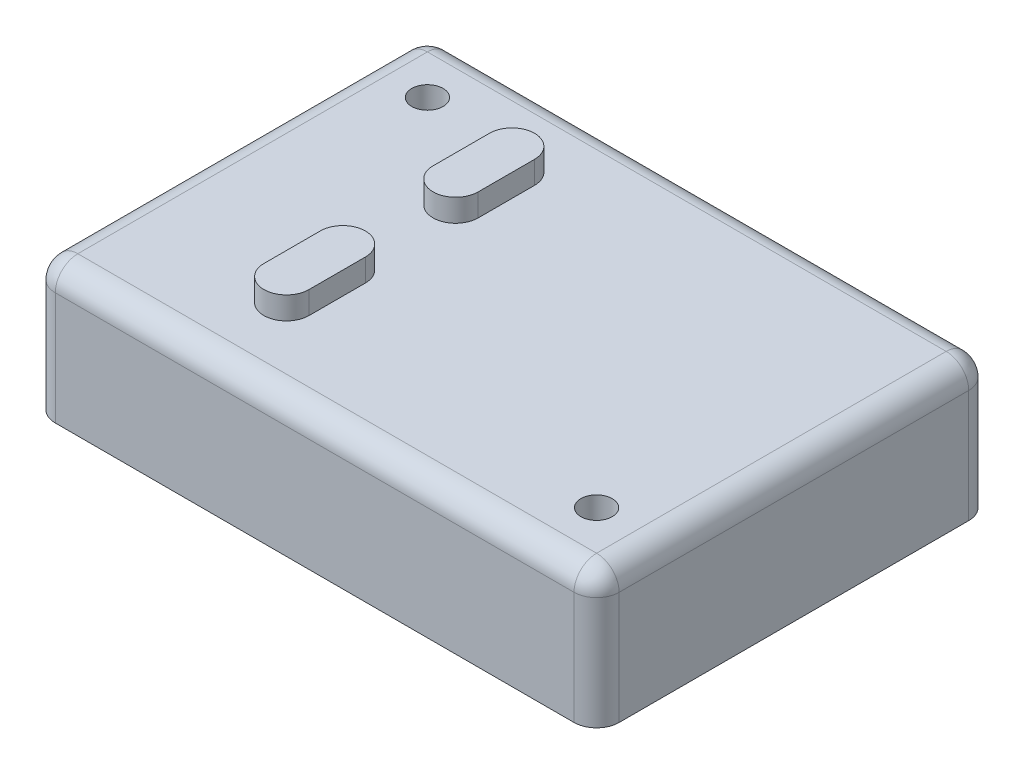
from build123d import *

# Parameters (mm, degrees)
SKETCH1_W           = 50
SKETCH1_H           = 35
BOSS_EXTRUDE1_DEPTH = 12
BOSS_EXTRUDE2_DEPTH = 2
FILLET1_R           = 2
SKETCH4_R           = 1.39
CUT_EXTRUDE1_DEPTH  = 34.574543928


with BuildPart() as part:
    # Sketch1 → Boss-Extrude1 (new body)
    with BuildSketch(Plane(origin=(0, 0, 0), x_dir=(1, 0, 0), z_dir=(0, 1, 0))):
        Rectangle(SKETCH1_W, SKETCH1_H)
    extrude(amount=BOSS_EXTRUDE1_DEPTH)

    # Sketch2 → Boss-Extrude2 (add)
    with BuildSketch(Plane(origin=(0, 12, 0), x_dir=(1, 0, 0), z_dir=(0, 1, 0))):
        with BuildLine():
            Line((-8, 10), (-8, 5))
            ThreePointArc((-8, 5), (-10, 3), (-12, 5))
            Line((-12, 5), (-12, 10))
            ThreePointArc((-12, 10), (-10, 12), (-8, 10))
        make_face()
        with BuildLine():
            Line((-8, -5), (-8, -10))
            ThreePointArc((-8, -10), (-10, -12), (-12, -10))
            Line((-12, -10), (-12, -5))
            ThreePointArc((-12, -5), (-10, -3), (-8, -5))
        make_face()
    extrude(amount=BOSS_EXTRUDE2_DEPTH)

    # Fillet1
    fillet1_edges = [part.edges().sort_by_distance(p)[0] for p in [
        (-25, 12, 0),
        (0, 12, -17.5),
        (-25, 6, -17.5),
        (25, 12, 0),
        (25, 6, -17.5),
        (-25, 6, 17.5),
        (0, 12, 17.5),
        (25, 6, 17.5),
    ]]
    fillet(fillet1_edges, radius=FILLET1_R)

    # Sketch4 → Cut-Extrude1 (cut, through all)
    with BuildSketch(Plane.XZ):
        with Locations((-19.5, -12)):
            Circle(SKETCH4_R)
        with Locations((19.5, 12)):
            Circle(SKETCH4_R)
    extrude(amount=-CUT_EXTRUDE1_DEPTH, mode=Mode.SUBTRACT)


solid = part.part
